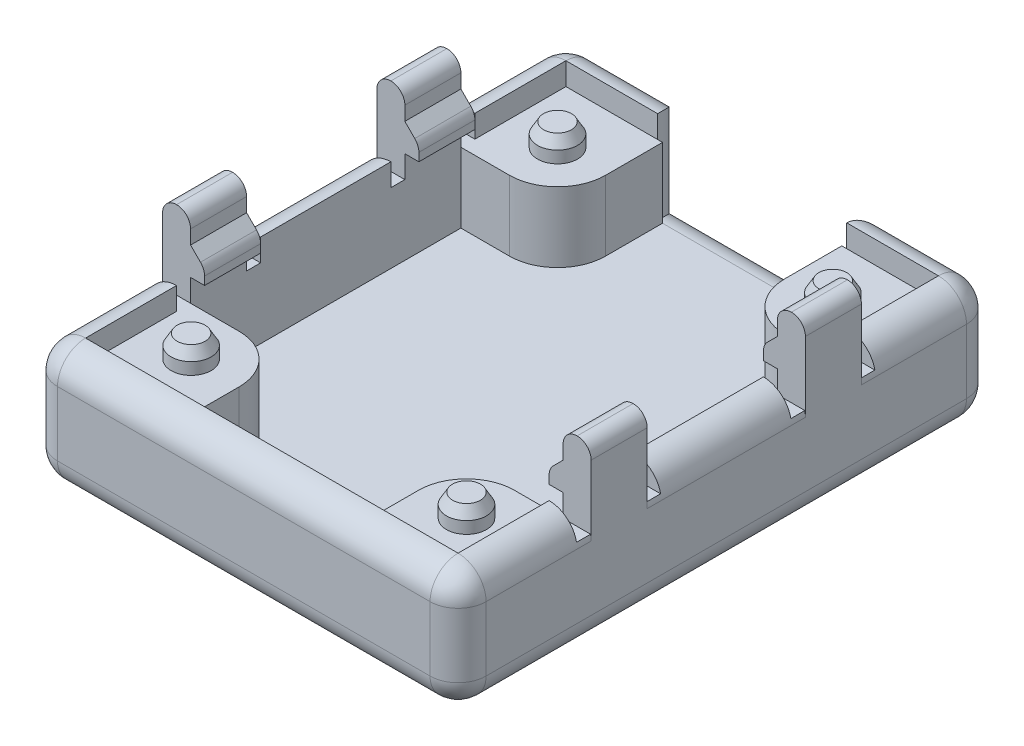
from build123d import *
from OCP.BRepFilletAPI import BRepFilletAPI_MakeChamfer

# Parameters (mm, degrees)
BASE_START          = -5
SKETCH6_W           = 30.6
SKETCH6_H           = 38.3
BASE_DEPTH          = 2
WALLS_DEPTH         = 6.6
SUPPORTS_REACH      = 27.491
SKETCH10_R          = 1.43
INSERTS_DEPTH       = 1.6
BOSS_EXTRUDE5_START = 9.65
BOSS_EXTRUDE5_DEPTH = 4
BOSS_EXTRUDE7_START = -9.65
BOSS_EXTRUDE7_DEPTH = 4
CUT_EXTRUDE1_REACH  = 27.491
SKETCH16_W          = 2
SKETCH16_H          = 1
FILLET1_R           = 2
FILLET2_R           = 1
CHAMFER1_SIZE       = 0.75
CHAMFER1_SIZE2      = 0.433012702


# Some blends are built 0.0001 mm under size
with BuildPart() as part:
    # Sketch6 → base (new body)
    with BuildSketch(Plane(origin=(0, 0, 0), x_dir=(1, 0, 0), z_dir=(0, 1, 0)).offset(BASE_START)):
        Rectangle(SKETCH6_W, SKETCH6_H)
    extrude(amount=-BASE_DEPTH)

    # Sketch8 → walls (add)
    with BuildSketch(Plane(origin=(0, -5, 0), x_dir=(1, 0, 0), z_dir=(0, 1, 0))):
        Polygon((6.75, 17.15), (6.75, 19.15), (15.3, 19.15), (15.3, -19.15), (-15.3, -19.15), (-15.3, 19.15), (-6.75, 19.15), (-6.75, 17.15), (-13.3, 17.15), (-13.3, -17.15), (13.3, -17.15), (13.3, 17.15), align=None)
    extrude(amount=WALLS_DEPTH)

    # Sketch9 → supports (add, up to next)
    with BuildSketch(Plane(origin=(0, 0, 0), x_dir=(1, 0, 0), z_dir=(0, 1, 0)), mode=Mode.PRIVATE) as supports_sk1:
        with BuildLine():
            Line((6.4, 13.08), (6.4, 17.15))
            Line((6.4, 17.15), (13.3, 17.15))
            Line((13.3, 17.15), (13.3, 9.65))
            Line((13.3, 9.65), (9.83, 9.65))
            ThreePointArc((9.83, 9.65), (7.404623741, 10.654623741), (6.4, 13.08))
        make_face()
    supports_tool1 = extrude(supports_sk1.sketch, amount=-SUPPORTS_REACH, mode=Mode.PRIVATE) - part.part
    # Sketch9 → supports (add, up to next)
    with BuildSketch(Plane(origin=(0, 0, 0), x_dir=(1, 0, 0), z_dir=(0, 1, 0)), mode=Mode.PRIVATE) as supports_sk2:
        with BuildLine():
            Line((-13.3, 9.65), (-9.83, 9.65))
            ThreePointArc((-9.83, 9.65), (-7.404623741, 10.654623741), (-6.4, 13.08))
            Line((-6.4, 13.08), (-6.4, 17.15))
            Line((-6.4, 17.15), (-13.3, 17.15))
            Line((-13.3, 17.15), (-13.3, 9.65))
        make_face()
    supports_tool2 = extrude(supports_sk2.sketch, amount=-SUPPORTS_REACH, mode=Mode.PRIVATE) - part.part
    # Sketch9 → supports (add, up to next)
    with BuildSketch(Plane(origin=(0, 0, 0), x_dir=(1, 0, 0), z_dir=(0, 1, 0)), mode=Mode.PRIVATE) as supports_sk3:
        with BuildLine():
            Line((-6.4, -13.08), (-6.4, -17.15))
            Line((-6.4, -17.15), (-13.3, -17.15))
            Line((-13.3, -17.15), (-13.3, -9.65))
            Line((-13.3, -9.65), (-9.83, -9.65))
            ThreePointArc((-9.83, -9.65), (-7.404623741, -10.654623741), (-6.4, -13.08))
        make_face()
    supports_tool3 = extrude(supports_sk3.sketch, amount=-SUPPORTS_REACH, mode=Mode.PRIVATE) - part.part
    # Sketch9 → supports (add, up to next)
    with BuildSketch(Plane(origin=(0, 0, 0), x_dir=(1, 0, 0), z_dir=(0, 1, 0)), mode=Mode.PRIVATE) as supports_sk4:
        with BuildLine():
            Line((13.3, -9.65), (9.83, -9.65))
            ThreePointArc((9.83, -9.65), (7.404623741, -10.654623741), (6.4, -13.08))
            Line((6.4, -13.08), (6.4, -17.15))
            Line((6.4, -17.15), (13.3, -17.15))
            Line((13.3, -17.15), (13.3, -9.65))
        make_face()
    supports_tool4 = extrude(supports_sk4.sketch, amount=-SUPPORTS_REACH, mode=Mode.PRIVATE) - part.part
    add(supports_tool1.solids().sort_by_distance((9.987655, 0, -13.553042))[0])
    add(supports_tool2.solids().sort_by_distance((-9.987655, 0, -13.553042))[0])
    add(supports_tool3.solids().sort_by_distance((-9.987655, 0, 13.553042))[0])
    add(supports_tool4.solids().sort_by_distance((9.987655, 0, 13.553042))[0])

    # Sketch10 → inserts (add)
    with BuildSketch(Plane(origin=(0, 0, 0), x_dir=(1, 0, 0), z_dir=(0, 1, 0))):
        with Locations(Location((9.83, -13.08, 0), (0, 0, 90))):
            Circle(SKETCH10_R)
        with Locations(Location((-9.83, -13.08, 0), (0, 0, 270))):
            Circle(SKETCH10_R)
        with Locations(Location((-9.83, 13.08, 0), (0, 0, 90))):
            Circle(SKETCH10_R)
        with Locations(Location((9.83, 13.08, 0), (0, 0, 270))):
            Circle(SKETCH10_R)
    extrude(amount=INSERTS_DEPTH)

    # Sketch13 → Boss-Extrude5 (add)
    with BuildSketch(Plane.XY.offset(BOSS_EXTRUDE5_START)):
        Polygon((-15.3, 5.6), (-15.3, 1.6), (-12.3, 1.6), (-12.3, 2.6), (-13.3, 3.6), (-13.3, 5.6), align=None)
        Polygon((15.3, 5.6), (13.3, 5.6), (13.3, 3.6), (12.3, 2.6), (12.3, 1.6), (15.3, 1.6), align=None)
    extrude(amount=-BOSS_EXTRUDE5_DEPTH)

    # Sketch15 → Boss-Extrude7 (add)
    with BuildSketch(Plane.XY.offset(BOSS_EXTRUDE7_START)):
        Polygon((-15.3, 1.6), (-15.3, 5.6), (-13.3, 5.6), (-13.3, 3.6), (-12.3, 2.6), (-12.3, 1.6), align=None)
        Polygon((12.3, 2.6), (13.3, 3.6), (13.3, 5.6), (15.3, 5.6), (15.3, 1.6), (12.3, 1.6), align=None)
    extrude(amount=BOSS_EXTRUDE7_DEPTH)

    # Sketch16 → Cut-Extrude1 (cut, up to next)
    with BuildSketch(Plane(origin=(0, 0, 0), x_dir=(1, 0, 0), z_dir=(0, 1, 0)), mode=Mode.PRIVATE) as cut_extrude1_sk1:
        with Locations((-14.3, 10.15)):
            Rectangle(SKETCH16_W, SKETCH16_H)
    cut_extrude1_tool1 = extrude(cut_extrude1_sk1.sketch, amount=CUT_EXTRUDE1_REACH, mode=Mode.PRIVATE) & part.part
    # Sketch16 → Cut-Extrude1 (cut, up to next)
    with BuildSketch(Plane(origin=(0, 0, 0), x_dir=(1, 0, 0), z_dir=(0, 1, 0)), mode=Mode.PRIVATE) as cut_extrude1_sk2:
        with Locations((-14.3, 5.15)):
            Rectangle(SKETCH16_W, SKETCH16_H)
    cut_extrude1_tool2 = extrude(cut_extrude1_sk2.sketch, amount=CUT_EXTRUDE1_REACH, mode=Mode.PRIVATE) & part.part
    # Sketch16 → Cut-Extrude1 (cut, up to next)
    with BuildSketch(Plane(origin=(0, 0, 0), x_dir=(1, 0, 0), z_dir=(0, 1, 0)), mode=Mode.PRIVATE) as cut_extrude1_sk3:
        with Locations((14.3, 5.15)):
            Rectangle(SKETCH16_W, SKETCH16_H)
    cut_extrude1_tool3 = extrude(cut_extrude1_sk3.sketch, amount=CUT_EXTRUDE1_REACH, mode=Mode.PRIVATE) & part.part
    # Sketch16 → Cut-Extrude1 (cut, up to next)
    with BuildSketch(Plane(origin=(0, 0, 0), x_dir=(1, 0, 0), z_dir=(0, 1, 0)), mode=Mode.PRIVATE) as cut_extrude1_sk4:
        with Locations((14.3, 10.15)):
            Rectangle(SKETCH16_W, SKETCH16_H)
    cut_extrude1_tool4 = extrude(cut_extrude1_sk4.sketch, amount=CUT_EXTRUDE1_REACH, mode=Mode.PRIVATE) & part.part
    # Sketch16 → Cut-Extrude1 (cut, up to next)
    with BuildSketch(Plane(origin=(0, 0, 0), x_dir=(1, 0, 0), z_dir=(0, 1, 0)), mode=Mode.PRIVATE) as cut_extrude1_sk5:
        with Locations((14.3, -10.15)):
            Rectangle(SKETCH16_W, SKETCH16_H)
    cut_extrude1_tool5 = extrude(cut_extrude1_sk5.sketch, amount=CUT_EXTRUDE1_REACH, mode=Mode.PRIVATE) & part.part
    # Sketch16 → Cut-Extrude1 (cut, up to next)
    with BuildSketch(Plane(origin=(0, 0, 0), x_dir=(1, 0, 0), z_dir=(0, 1, 0)), mode=Mode.PRIVATE) as cut_extrude1_sk6:
        with Locations((14.3, -5.15)):
            Rectangle(SKETCH16_W, SKETCH16_H)
    cut_extrude1_tool6 = extrude(cut_extrude1_sk6.sketch, amount=CUT_EXTRUDE1_REACH, mode=Mode.PRIVATE) & part.part
    # Sketch16 → Cut-Extrude1 (cut, up to next)
    with BuildSketch(Plane(origin=(0, 0, 0), x_dir=(1, 0, 0), z_dir=(0, 1, 0)), mode=Mode.PRIVATE) as cut_extrude1_sk7:
        with Locations((-14.3, -5.15)):
            Rectangle(SKETCH16_W, SKETCH16_H)
    cut_extrude1_tool7 = extrude(cut_extrude1_sk7.sketch, amount=CUT_EXTRUDE1_REACH, mode=Mode.PRIVATE) & part.part
    # Sketch16 → Cut-Extrude1 (cut, up to next)
    with BuildSketch(Plane(origin=(0, 0, 0), x_dir=(1, 0, 0), z_dir=(0, 1, 0)), mode=Mode.PRIVATE) as cut_extrude1_sk8:
        with Locations((-14.3, -10.15)):
            Rectangle(SKETCH16_W, SKETCH16_H)
    cut_extrude1_tool8 = extrude(cut_extrude1_sk8.sketch, amount=CUT_EXTRUDE1_REACH, mode=Mode.PRIVATE) & part.part
    add(cut_extrude1_tool1.solids().sort_by_distance((-14.3, 0, -10.15))[0], mode=Mode.SUBTRACT)
    add(cut_extrude1_tool2.solids().sort_by_distance((-14.3, 0, -5.15))[0], mode=Mode.SUBTRACT)
    add(cut_extrude1_tool3.solids().sort_by_distance((14.3, 0, -5.15))[0], mode=Mode.SUBTRACT)
    add(cut_extrude1_tool4.solids().sort_by_distance((14.3, 0, -10.15))[0], mode=Mode.SUBTRACT)
    add(cut_extrude1_tool5.solids().sort_by_distance((14.3, 0, 10.15))[0], mode=Mode.SUBTRACT)
    add(cut_extrude1_tool6.solids().sort_by_distance((14.3, 0, 5.15))[0], mode=Mode.SUBTRACT)
    add(cut_extrude1_tool7.solids().sort_by_distance((-14.3, 0, 5.15))[0], mode=Mode.SUBTRACT)
    add(cut_extrude1_tool8.solids().sort_by_distance((-14.3, 0, 10.15))[0], mode=Mode.SUBTRACT)

    # Fillet1
    # the kernel refuses this fillet: 2 mm, written as the material it takes off along each edge
    with BuildSketch(Plane(origin=(-13.3, -0.4, -17.15), x_dir=(0, 1, 0), z_dir=(-1, 0, 0))) as fillet1_piece_1_section:
        Polygon((0, 0), (FILLET1_R * 1.02, 0), (FILLET1_R * 1.02, FILLET1_R * 1.02), (0, FILLET1_R * 1.02), align=None)
    fillet1_piece_1 = extrude(amount=FILLET1_R * 1.02, mode=Mode.PRIVATE)
    fillet1_piece_1 = fillet1_piece_1 - Plane(origin=(-13.3, -0.4, -17.15), x_dir=(0, -0.7071067811865475, 0.7071067811865475), z_dir=(-1, 0, 0)) * Sphere(FILLET1_R, mode=Mode.PRIVATE)
    add(fillet1_piece_1, mode=Mode.SUBTRACT)
    with BuildSketch(Plane(origin=(13.3, -5, -17.15), x_dir=(1, 0, 0), z_dir=(0, 0, -1))) as fillet1_piece_2_section:
        Polygon((0, 0), (FILLET1_R * 1.02, 0), (FILLET1_R * 1.02, FILLET1_R * 1.02), (0, FILLET1_R * 1.02), align=None)
    fillet1_piece_2 = extrude(amount=FILLET1_R * 1.02, mode=Mode.PRIVATE)
    fillet1_piece_2 = fillet1_piece_2 - Plane(origin=(13.3, -5, -17.15), x_dir=(-0.7071067811865475, 0.7071067811865475, 0), z_dir=(0, 0, -1)) * Sphere(FILLET1_R, mode=Mode.PRIVATE)
    add(fillet1_piece_2, mode=Mode.SUBTRACT)
    with BuildSketch(Plane(origin=(-13.3, -5, -17.15), x_dir=(0, 0, -1), z_dir=(-1, 0, 0))) as fillet1_piece_3_section:
        Polygon((0, 0), (FILLET1_R * 1.02, 0), (FILLET1_R * 1.02, FILLET1_R * 1.02), (0, FILLET1_R * 1.02), align=None)
    fillet1_piece_3 = extrude(amount=FILLET1_R * 1.02, mode=Mode.PRIVATE)
    fillet1_piece_3 = fillet1_piece_3 - Plane(origin=(-13.3, -5, -17.15), x_dir=(0, 0.7071067811865475, 0.7071067811865475), z_dir=(-1, 0, 0)) * Sphere(FILLET1_R, mode=Mode.PRIVATE)
    add(fillet1_piece_3, mode=Mode.SUBTRACT)
    with BuildSketch(Plane(origin=(13.3, -0.4, -17.15), x_dir=(1, 0, 0), z_dir=(0, 1, 0))) as fillet1_piece_4_section:
        Polygon((0, 0), (FILLET1_R * 1.02, 0), (FILLET1_R * 1.02, FILLET1_R * 1.02), (0, FILLET1_R * 1.02), align=None)
    fillet1_piece_4 = extrude(amount=FILLET1_R * 1.02, mode=Mode.PRIVATE)
    fillet1_piece_4 = fillet1_piece_4 - Plane(origin=(13.3, -0.4, -17.15), x_dir=(-0.7071067811865475, 0, 0.7071067811865475), z_dir=(0, 1, 0)) * Sphere(FILLET1_R, mode=Mode.PRIVATE)
    add(fillet1_piece_4, mode=Mode.SUBTRACT)
    with BuildSketch(Plane(origin=(-13.3, -0.4, 17.15), x_dir=(-1, 0, 0), z_dir=(0, 0, 1))) as fillet1_piece_5_section:
        Polygon((0, 0), (FILLET1_R * 1.02, 0), (FILLET1_R * 1.02, -FILLET1_R * 1.02), (0, -FILLET1_R * 1.02), align=None)
    fillet1_piece_5 = extrude(amount=FILLET1_R * 1.02, mode=Mode.PRIVATE)
    fillet1_piece_5 = fillet1_piece_5 - Plane(origin=(-13.3, -0.4, 17.15), x_dir=(0.7071067811865475, -0.7071067811865475, 0), z_dir=(0, 0, 1)) * Sphere(FILLET1_R, mode=Mode.PRIVATE)
    add(fillet1_piece_5, mode=Mode.SUBTRACT)
    with BuildSketch(Plane(origin=(-13.3, -5, 17.15), x_dir=(-1, 0, 0), z_dir=(0, 0, 1))) as fillet1_piece_6_section:
        Polygon((0, 0), (FILLET1_R * 1.02, 0), (FILLET1_R * 1.02, FILLET1_R * 1.02), (0, FILLET1_R * 1.02), align=None)
    fillet1_piece_6 = extrude(amount=FILLET1_R * 1.02, mode=Mode.PRIVATE)
    fillet1_piece_6 = fillet1_piece_6 - Plane(origin=(-13.3, -5, 17.15), x_dir=(0.7071067811865475, 0.7071067811865475, 0), z_dir=(0, 0, 1)) * Sphere(FILLET1_R, mode=Mode.PRIVATE)
    add(fillet1_piece_6, mode=Mode.SUBTRACT)
    with BuildSketch(Plane(origin=(13.3, -5, 17.15), x_dir=(1, 0, 0), z_dir=(0, 0, 1))) as fillet1_piece_7_section:
        Polygon((0, 0), (FILLET1_R * 1.02, 0), (FILLET1_R * 1.02, -FILLET1_R * 1.02), (0, -FILLET1_R * 1.02), align=None)
    fillet1_piece_7 = extrude(amount=FILLET1_R * 1.02, mode=Mode.PRIVATE)
    fillet1_piece_7 = fillet1_piece_7 - Plane(origin=(13.3, -5, 17.15), x_dir=(-0.7071067811865475, 0.7071067811865475, 0), z_dir=(0, 0, 1)) * Sphere(FILLET1_R, mode=Mode.PRIVATE)
    add(fillet1_piece_7, mode=Mode.SUBTRACT)
    with BuildSketch(Plane(origin=(13.3, -0.4, 17.15), x_dir=(0, 1, 0), z_dir=(0, 0, 1))) as fillet1_piece_8_section:
        Polygon((0, 0), (FILLET1_R * 1.02, 0), (FILLET1_R * 1.02, -FILLET1_R * 1.02), (0, -FILLET1_R * 1.02), align=None)
    fillet1_piece_8 = extrude(amount=FILLET1_R * 1.02, mode=Mode.PRIVATE)
    fillet1_piece_8 = fillet1_piece_8 - Plane(origin=(13.3, -0.4, 17.15), x_dir=(-0.7071067811865475, -0.7071067811865475, 0), z_dir=(0, 0, 1)) * Sphere(FILLET1_R, mode=Mode.PRIVATE)
    add(fillet1_piece_8, mode=Mode.SUBTRACT)
    with BuildSketch(Plane(origin=(-6.75, -5, -19.15), x_dir=(0, 0, 1), z_dir=(0, 1, 0))) as fillet1_piece_9:
        with BuildLine():
            CenterArc((FILLET1_R, -FILLET1_R), FILLET1_R, 90, 90)
            Line((0, -FILLET1_R), (0, 0))
            Line((0, 0), (FILLET1_R, 0))
        make_face()
    extrude(amount=11.6, mode=Mode.SUBTRACT)
    with BuildSketch(Plane(origin=(-13.3, 1.6, -19.15), x_dir=(0, 0, 1), z_dir=(1, 0, 0)), Plane(origin=(1.75, 1.6, -19.15), x_dir=(0, 0, 1), z_dir=(1, 0, 0))) as fillet1_piece_10:
        with BuildLine():
            CenterArc((FILLET1_R, FILLET1_R), FILLET1_R, 180, 90)
            Line((0, FILLET1_R), (0, 0))
            Line((0, 0), (FILLET1_R, 0))
        make_face()
    extrude(amount=11.55, mode=Mode.SUBTRACT)
    with BuildSketch(Plane(origin=(13.3, -7, -19.15), x_dir=(0, 1, 0), z_dir=(-1, 0, 0)), Plane(origin=(-13.3, -7, 19.15), x_dir=(0, 1, 0), z_dir=(1, 0, 0)), Plane(origin=(13.3, 1.6, 19.15), x_dir=(0, -1, 0), z_dir=(-1, 0, 0))) as fillet1_piece_11:
        with BuildLine():
            CenterArc((FILLET1_R, -FILLET1_R), FILLET1_R, 90, 90)
            Line((0, -FILLET1_R), (0, 0))
            Line((0, 0), (FILLET1_R, 0))
        make_face()
    extrude(amount=26.6, mode=Mode.SUBTRACT)
    with BuildSketch(Plane(origin=(6.75, -5, -19.15), x_dir=(0, 0, 1), z_dir=(0, 1, 0))) as fillet1_piece_12:
        with BuildLine():
            CenterArc((FILLET1_R, FILLET1_R), FILLET1_R, 180, 90)
            Line((0, FILLET1_R), (0, 0))
            Line((0, 0), (FILLET1_R, 0))
        make_face()
    extrude(amount=11.6, mode=Mode.SUBTRACT)
    with BuildSketch(Plane(origin=(6.75, -5, -19.15), x_dir=(0, 0, 1), z_dir=(-1, 0, 0))) as fillet1_piece_13:
        with BuildLine():
            CenterArc((FILLET1_R, -FILLET1_R), FILLET1_R, 90, 90)
            Line((0, -FILLET1_R), (0, 0))
            Line((0, 0), (FILLET1_R, 0))
        make_face()
    extrude(amount=13.5, mode=Mode.SUBTRACT)
    with BuildSketch(Plane(origin=(-15.3, 1.6, 9.65), x_dir=(0, -1, 0), z_dir=(0, 0, -1))) as fillet1_piece_14_section:
        with BuildLine():
            CenterArc((FILLET1_R, -FILLET1_R), FILLET1_R, 90, 90)
            Line((0, -FILLET1_R), (0, 0))
            Line((0, 0), (FILLET1_R, 0))
        make_face()
    fillet1_piece_14 = extrude(amount=19.3, mode=Mode.PRIVATE)
    fillet1_piece_14 = split(fillet1_piece_14, bisect_by=Plane(origin=(-15.3, 1.6, -5.65), z_dir=(0, 0, 1)), keep=Keep.TOP, mode=Mode.PRIVATE)
    fillet1_piece_14 = split(fillet1_piece_14, bisect_by=Plane(origin=(-15.3, 1.6, 5.65), z_dir=(0, 0, -1)), keep=Keep.TOP, mode=Mode.PRIVATE)
    add(fillet1_piece_14, mode=Mode.SUBTRACT)
    with BuildSketch(Plane(origin=(-15.3, 1.6, 17.15), x_dir=(0, -1, 0), z_dir=(0, 0, -1))) as fillet1_piece_15_section:
        with BuildLine():
            CenterArc((FILLET1_R, -FILLET1_R), FILLET1_R, 90, 90)
            Line((0, -FILLET1_R), (0, 0))
            Line((0, 0), (FILLET1_R, 0))
        make_face()
    fillet1_piece_15 = extrude(amount=11.5, mode=Mode.PRIVATE)
    fillet1_piece_15 = split(fillet1_piece_15, bisect_by=Plane(origin=(-15.3, 1.6, 9.65), z_dir=(0, 0, 1)), keep=Keep.TOP, mode=Mode.PRIVATE)
    add(fillet1_piece_15, mode=Mode.SUBTRACT)
    with BuildSketch(Plane(origin=(-15.3, -7, -17.15), x_dir=(0, 1, 0), z_dir=(0, 0, 1)), Plane(origin=(15.3, -7, 17.15), x_dir=(0, 1, 0), z_dir=(0, 0, -1))) as fillet1_piece_16:
        with BuildLine():
            CenterArc((FILLET1_R, -FILLET1_R), FILLET1_R, 90, 90)
            Line((0, -FILLET1_R), (0, 0))
            Line((0, 0), (FILLET1_R, 0))
        make_face()
    extrude(amount=34.3, mode=Mode.SUBTRACT)
    with BuildSketch(Plane(origin=(-15.3, -0.4, -19.15), x_dir=(0, 0, 1), z_dir=(0, -1, 0)), Plane(origin=(-15.3, -0.4, 19.15), x_dir=(1, 0, 0), z_dir=(0, -1, 0)), Plane(origin=(15.3, -5, 19.15), x_dir=(-1, 0, 0), z_dir=(0, 1, 0))) as fillet1_piece_17:
        with BuildLine():
            CenterArc((FILLET1_R, -FILLET1_R), FILLET1_R, 90, 90)
            Line((0, -FILLET1_R), (0, 0))
            Line((0, 0), (FILLET1_R, 0))
        make_face()
    extrude(amount=4.6, mode=Mode.SUBTRACT)
    with BuildSketch(Plane(origin=(-15.3, 1.6, -5.65), x_dir=(0, -1, 0), z_dir=(0, 0, -1))) as fillet1_piece_18_section:
        with BuildLine():
            CenterArc((FILLET1_R, -FILLET1_R), FILLET1_R, 90, 90)
            Line((0, -FILLET1_R), (0, 0))
            Line((0, 0), (FILLET1_R, 0))
        make_face()
    fillet1_piece_18 = extrude(amount=11.5, mode=Mode.PRIVATE)
    fillet1_piece_18 = split(fillet1_piece_18, bisect_by=Plane(origin=(-15.3, 1.6, -9.65), z_dir=(0, 0, -1)), keep=Keep.TOP, mode=Mode.PRIVATE)
    add(fillet1_piece_18, mode=Mode.SUBTRACT)
    with BuildSketch(Plane(origin=(15.3, 1.6, -9.65), x_dir=(-1, 0, 0), z_dir=(0, 0, 1))) as fillet1_piece_19_section:
        with BuildLine():
            CenterArc((FILLET1_R, FILLET1_R), FILLET1_R, 180, 90)
            Line((0, FILLET1_R), (0, 0))
            Line((0, 0), (FILLET1_R, 0))
        make_face()
    fillet1_piece_19 = extrude(amount=19.3, mode=Mode.PRIVATE)
    fillet1_piece_19 = split(fillet1_piece_19, bisect_by=Plane(origin=(15.3, 1.6, 5.65), z_dir=(0, 0, -1)), keep=Keep.TOP, mode=Mode.PRIVATE)
    fillet1_piece_19 = split(fillet1_piece_19, bisect_by=Plane(origin=(15.3, 1.6, -5.65), z_dir=(0, 0, 1)), keep=Keep.TOP, mode=Mode.PRIVATE)
    add(fillet1_piece_19, mode=Mode.SUBTRACT)
    with BuildSketch(Plane(origin=(15.3, 1.6, -17.15), x_dir=(-1, 0, 0), z_dir=(0, 0, 1))) as fillet1_piece_20_section:
        with BuildLine():
            CenterArc((FILLET1_R, FILLET1_R), FILLET1_R, 180, 90)
            Line((0, FILLET1_R), (0, 0))
            Line((0, 0), (FILLET1_R, 0))
        make_face()
    fillet1_piece_20 = extrude(amount=11.5, mode=Mode.PRIVATE)
    fillet1_piece_20 = split(fillet1_piece_20, bisect_by=Plane(origin=(15.3, 1.6, -9.65), z_dir=(0, 0, -1)), keep=Keep.TOP, mode=Mode.PRIVATE)
    add(fillet1_piece_20, mode=Mode.SUBTRACT)
    with BuildSketch(Plane(origin=(15.3, -5, -19.15), x_dir=(-1, 0, 0), z_dir=(0, 1, 0))) as fillet1_piece_21:
        with BuildLine():
            CenterArc((FILLET1_R, FILLET1_R), FILLET1_R, 180, 90)
            Line((0, FILLET1_R), (0, 0))
            Line((0, 0), (FILLET1_R, 0))
        make_face()
    extrude(amount=4.6, mode=Mode.SUBTRACT)
    with BuildSketch(Plane(origin=(15.3, 1.6, 5.65), x_dir=(-1, 0, 0), z_dir=(0, 0, 1))) as fillet1_piece_22_section:
        with BuildLine():
            CenterArc((FILLET1_R, FILLET1_R), FILLET1_R, 180, 90)
            Line((0, FILLET1_R), (0, 0))
            Line((0, 0), (FILLET1_R, 0))
        make_face()
    fillet1_piece_22 = extrude(amount=11.5, mode=Mode.PRIVATE)
    fillet1_piece_22 = split(fillet1_piece_22, bisect_by=Plane(origin=(15.3, 1.6, 9.65), z_dir=(0, 0, 1)), keep=Keep.TOP, mode=Mode.PRIVATE)
    add(fillet1_piece_22, mode=Mode.SUBTRACT)
    with BuildSketch(Plane(origin=(-6.75, -10, -19.15), x_dir=(0, 0, 1), z_dir=(0, 1, 0))) as fillet1_piece_23a_section:
        with BuildLine():
            CenterArc((FILLET1_R, -FILLET1_R), FILLET1_R, 90, 90)
            Line((0, -FILLET1_R), (0, 0))
            Line((0, 0), (FILLET1_R, 0))
        make_face()
    fillet1_piece_23a = extrude(amount=11.6, mode=Mode.PRIVATE)
    fillet1_piece_23a = split(fillet1_piece_23a, bisect_by=Plane(origin=(-6.75, -5, -19.15), z_dir=(0, -1, 0)), keep=Keep.TOP, mode=Mode.PRIVATE)
    fillet1_piece_23a = split(fillet1_piece_23a, bisect_by=Plane(origin=(-6.75, -7, -19.15), z_dir=(0, 1, 0)), keep=Keep.TOP, mode=Mode.PRIVATE)
    with BuildSketch(Plane(origin=(6.75, -5, -19.15), x_dir=(0, 0, 1), z_dir=(-1, 0, 0))) as fillet1_piece_23b_section:
        with BuildLine():
            CenterArc((FILLET1_R, -FILLET1_R), FILLET1_R, 90, 90)
            Line((0, -FILLET1_R), (0, 0))
            Line((0, 0), (FILLET1_R, 0))
        make_face()
    fillet1_piece_23b = extrude(amount=18.5, mode=Mode.PRIVATE)
    fillet1_piece_23b = split(fillet1_piece_23b, bisect_by=Plane(origin=(-6.75, -5, -19.15), z_dir=(-1, 0, 0)), keep=Keep.TOP, mode=Mode.PRIVATE)
    fillet1_piece_23 = fillet1_piece_23a & fillet1_piece_23b
    add(fillet1_piece_23, mode=Mode.SUBTRACT)
    with BuildSketch(Plane(origin=(11.75, -5, -19.15), x_dir=(0, 0, 1), z_dir=(-1, 0, 0))) as fillet1_piece_24a_section:
        with BuildLine():
            CenterArc((FILLET1_R, -FILLET1_R), FILLET1_R, 90, 90)
            Line((0, -FILLET1_R), (0, 0))
            Line((0, 0), (FILLET1_R, 0))
        make_face()
    fillet1_piece_24a = extrude(amount=18.5, mode=Mode.PRIVATE)
    fillet1_piece_24a = split(fillet1_piece_24a, bisect_by=Plane(origin=(6.75, -5, -19.15), z_dir=(1, 0, 0)), keep=Keep.TOP, mode=Mode.PRIVATE)
    with BuildSketch(Plane(origin=(6.75, -10, -19.15), x_dir=(0, 0, 1), z_dir=(0, 1, 0))) as fillet1_piece_24b_section:
        with BuildLine():
            CenterArc((FILLET1_R, FILLET1_R), FILLET1_R, 180, 90)
            Line((0, FILLET1_R), (0, 0))
            Line((0, 0), (FILLET1_R, 0))
        make_face()
    fillet1_piece_24b = extrude(amount=11.6, mode=Mode.PRIVATE)
    fillet1_piece_24b = split(fillet1_piece_24b, bisect_by=Plane(origin=(6.75, -5, -19.15), z_dir=(0, -1, 0)), keep=Keep.TOP, mode=Mode.PRIVATE)
    fillet1_piece_24b = split(fillet1_piece_24b, bisect_by=Plane(origin=(6.75, -7, -19.15), z_dir=(0, 1, 0)), keep=Keep.TOP, mode=Mode.PRIVATE)
    fillet1_piece_24 = fillet1_piece_24a & fillet1_piece_24b
    add(fillet1_piece_24, mode=Mode.SUBTRACT)

    # Fillet2
    fillet2_edges = [part.edges().sort_by_distance(p)[0] for p in [
        (12.3, 2.6, 7.65),
        (12.3, 2.6, -7.65),
        (-12.3, 2.6, -7.65),
        (-12.3, 2.6, 7.65),
        (15.3, 5.6, -7.65),
        (13.3, 5.6, -7.65),
        (15.3, 5.6, 7.65),
        (13.3, 5.6, 7.65),
        (-13.3, 5.6, -7.65),
        (-15.3, 5.6, -7.65),
        (-15.3, 5.6, 7.65),
        (-13.3, 5.6, 7.65),
    ]]
    fillet(fillet2_edges, radius=FILLET2_R - 0.0001)  # a hair under: the kernel refuses the full size

    # Chamfer1: one chamfer whose edges measure the first distance from different faces: ONE call of the kernel's chamfer builder (chamfer() names one face for all edges)
    chamfer1_edges_1 = [part.edges().sort_by_distance(p)[0] for p in [
        (9.83, 1.6, 14.51),
    ]]
    chamfer1_side_1 = [part.faces().sort_by_distance(p)[0] for p in [
        (9.83, 0.8, 14.51),
    ]]
    chamfer1_edges_2 = [part.edges().sort_by_distance(p)[0] for p in [
        (-9.83, 1.6, 11.65),
    ]]
    chamfer1_side_2 = [part.faces().sort_by_distance(p)[0] for p in [
        (-9.83, 0.8, 11.65),
    ]]
    chamfer1_edges_3 = [part.edges().sort_by_distance(p)[0] for p in [
        (-9.83, 1.6, -11.65),
    ]]
    chamfer1_side_3 = [part.faces().sort_by_distance(p)[0] for p in [
        (-9.83, 0.8, -11.65),
    ]]
    chamfer1_edges_4 = [part.edges().sort_by_distance(p)[0] for p in [
        (9.83, 1.6, -14.51),
    ]]
    chamfer1_side_4 = [part.faces().sort_by_distance(p)[0] for p in [
        (9.83, 0.8, -14.51),
    ]]
    chamfer1 = BRepFilletAPI_MakeChamfer(part.part.solid().wrapped)
    for e in chamfer1_edges_1:
        chamfer1.Add(CHAMFER1_SIZE, CHAMFER1_SIZE2, e.wrapped, chamfer1_side_1[0].wrapped)  # the first distance lies on this face
    for e in chamfer1_edges_2:
        chamfer1.Add(CHAMFER1_SIZE, CHAMFER1_SIZE2, e.wrapped, chamfer1_side_2[0].wrapped)  # the first distance lies on this face
    for e in chamfer1_edges_3:
        chamfer1.Add(CHAMFER1_SIZE, CHAMFER1_SIZE2, e.wrapped, chamfer1_side_3[0].wrapped)  # the first distance lies on this face
    for e in chamfer1_edges_4:
        chamfer1.Add(CHAMFER1_SIZE, CHAMFER1_SIZE2, e.wrapped, chamfer1_side_4[0].wrapped)  # the first distance lies on this face
    add(Compound.cast(chamfer1.Shape()), mode=Mode.REPLACE)


solid = part.part
